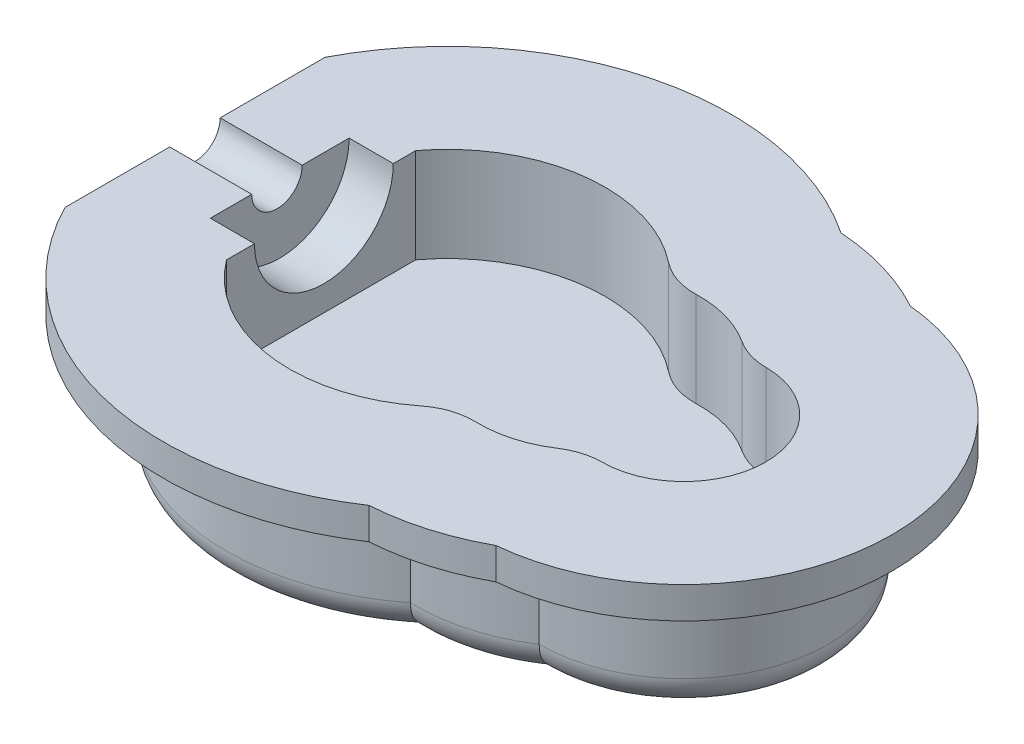
from build123d import *

# Parameters (mm, degrees)
SKETCH1_R           = 4
SKETCH1_R_2         = 11
BOSS_EXTRUDE1_DEPTH = 10
BOSS_EXTRUDE2_DEPTH = 20
BOSS_EXTRUDE3_DEPTH = 5
SKETCH6_R           = 11
CUT_EXTRUDE2_DEPTH  = 7
CUT_EXTRUDE3_REACH  = 123.903
SKETCH3_R           = 4
FILLET1_R           = 5


with BuildPart() as part:
    # Sketch1 → Boss-Extrude1 (new body)
    # profile 1 of 4: a face of its own
    with BuildSketch(Plane(origin=(0, 0, 0), x_dir=(1, 0, 0), z_dir=(0, 1, 0))):
        with BuildLine():
            ThreePointArc((-15.53030303, -17.49196326), (-18.965809959, -17.990656132), (-22.023809524, -19.633836312))
            ThreePointArc((-22.023809524, -19.633836312), (-40.737950416, -24.78942672), (-57.5, -15))
            Line((-57.5, -15), (-57.5, 15))
            ThreePointArc((-57.5, 15), (-40.737950416, 24.78942672), (-22.023809524, 19.633836312))
            ThreePointArc((-22.023809524, 19.633836312), (-18.965809959, 17.990656132), (-15.53030303, 17.49196326))
            ThreePointArc((-15.53030303, 17.49196326), (-10.248929974, 16.842723462), (-5.406818182, 14.63628582))
            ThreePointArc((-5.406818182, 14.63628582), (-2.801045952, 13.422385369), (0.042391304, 12.999930884))
            ThreePointArc((0.042391304, 12.999930884), (13, 0), (0.042391304, -12.999930884))
            ThreePointArc((0.042391304, -12.999930884), (-2.801045952, -13.422385369), (-5.406818182, -14.63628582))
            ThreePointArc((-5.406818182, -14.63628582), (-10.248929974, -16.842723462), (-15.53030303, -17.49196326))
        make_face()
        with Locations((-37.5, 0)):
            Circle(SKETCH1_R, mode=Mode.SUBTRACT)
        Circle(SKETCH1_R_2, mode=Mode.SUBTRACT)
        with Locations((-15, 0)):
            Circle(SKETCH1_R, mode=Mode.SUBTRACT)
    # profile 2 of 4: a face of its own
    with BuildSketch(Plane(origin=(0, 0, 0), x_dir=(1, 0, 0), z_dir=(0, 1, 0))):
        with Locations((-37.5, 0)):
            Circle(SKETCH1_R)
    # profile 3 of 4: a face of its own
    with BuildSketch(Plane(origin=(0, 0, 0), x_dir=(1, 0, 0), z_dir=(0, 1, 0))):
        with Locations((-15, 0)):
            Circle(SKETCH1_R)
    # profile 4 of 4: a face of its own
    with BuildSketch(Plane(origin=(0, 0, 0), x_dir=(1, 0, 0), z_dir=(0, 1, 0))):
        Circle(SKETCH1_R_2)
    extrude(amount=BOSS_EXTRUDE1_DEPTH)

    # Sketch1<3> → Boss-Extrude2 (add)
    with BuildSketch(Plane(origin=(0, 0, 0), x_dir=(1, 0, 0), z_dir=(0, 1, 0))):
        with BuildLine():
            Line((-67.5, -18.027756377), (-67.5, 18.027756377))
            ThreePointArc((-67.5, 18.027756377), (-43.803347329, 34.427718665), (-15.833333333, 27.487370837))
            ThreePointArc((-15.833333333, 27.487370837), (-7.534032816, 26.467136868), (0.075, 22.999877717))
            ThreePointArc((0.075, 22.999877717), (23, 0), (0.075, -22.999877717))
            ThreePointArc((0.075, -22.999877717), (-7.534032816, -26.467136868), (-15.833333333, -27.487370837))
            ThreePointArc((-15.833333333, -27.487370837), (-43.803347329, -34.427718665), (-67.5, -18.027756377))
        make_face()
        with BuildLine():
            Line((-57.5, -15), (-57.5, 15))
            ThreePointArc((-57.5, 15), (-40.737950416, 24.78942672), (-22.023809524, 19.633836312))
            ThreePointArc((-22.023809524, 19.633836312), (-18.965809959, 17.990656132), (-15.53030303, 17.49196326))
            ThreePointArc((-15.53030303, 17.49196326), (-10.248929974, 16.842723462), (-5.406818182, 14.63628582))
            ThreePointArc((-5.406818182, 14.63628582), (-2.801045952, 13.422385369), (0.042391304, 12.999930884))
            ThreePointArc((0.042391304, 12.999930884), (13, 0), (0.042391304, -12.999930884))
            ThreePointArc((0.042391304, -12.999930884), (-2.801045952, -13.422385369), (-5.406818182, -14.63628582))
            ThreePointArc((-5.406818182, -14.63628582), (-10.248929974, -16.842723462), (-15.53030303, -17.49196326))
            ThreePointArc((-15.53030303, -17.49196326), (-18.965809959, -17.990656132), (-22.023809524, -19.633836312))
            ThreePointArc((-22.023809524, -19.633836312), (-40.737950416, -24.78942672), (-57.5, -15))
        make_face(mode=Mode.SUBTRACT)
    extrude(amount=BOSS_EXTRUDE2_DEPTH)

    # Sketch2 → Boss-Extrude3 (add)
    with BuildSketch(Plane(origin=(0, 20, 0), x_dir=(1, 0, 0), z_dir=(0, 1, 0))):
        with BuildLine():
            Line((-77.5, -20.615528128), (-77.5, 20.615528128))
            ThreePointArc((-77.5, 20.615528128), (-48.761384661, 43.568121551), (-12.5, 37.416573868))
            ThreePointArc((-12.5, 37.416573868), (-4.462855904, 35.989145507), (3.075, 32.856420605))
            ThreePointArc((3.075, 32.856420605), (33, 0), (3.075, -32.856420605))
            ThreePointArc((3.075, -32.856420605), (-4.462855904, -35.989145507), (-12.5, -37.416573868))
            ThreePointArc((-12.5, -37.416573868), (-48.761384661, -43.568121551), (-77.5, -20.615528128))
        make_face()
        with BuildLine():
            Line((-57.5, -15), (-57.5, 15))
            ThreePointArc((-57.5, 15), (-40.737950416, 24.78942672), (-22.023809524, 19.633836312))
            ThreePointArc((-22.023809524, 19.633836312), (-18.965809959, 17.990656132), (-15.53030303, 17.49196326))
            ThreePointArc((-15.53030303, 17.49196326), (-10.248929974, 16.842723462), (-5.406818182, 14.63628582))
            ThreePointArc((-5.406818182, 14.63628582), (-2.801045952, 13.422385369), (0.042391304, 12.999930884))
            ThreePointArc((0.042391304, 12.999930884), (13, 0), (0.042391304, -12.999930884))
            ThreePointArc((0.042391304, -12.999930884), (-2.801045952, -13.422385369), (-5.406818182, -14.63628582))
            ThreePointArc((-5.406818182, -14.63628582), (-10.248929974, -16.842723462), (-15.53030303, -17.49196326))
            ThreePointArc((-15.53030303, -17.49196326), (-18.965809959, -17.990656132), (-22.023809524, -19.633836312))
            ThreePointArc((-22.023809524, -19.633836312), (-40.737950416, -24.78942672), (-57.5, -15))
        make_face(mode=Mode.SUBTRACT)
    extrude(amount=BOSS_EXTRUDE3_DEPTH)

    # Sketch6 → Cut-Extrude2 (cut)
    with BuildSketch(Plane(origin=(-57.5, 0, 0), x_dir=(0, 0, -1), z_dir=(1, 0, 0))):
        with Locations((0.437281594, 25)):
            Circle(SKETCH6_R)
    extrude(amount=-CUT_EXTRUDE2_DEPTH, mode=Mode.SUBTRACT)

    # Sketch3 → Cut-Extrude3 (cut, up to next)
    with BuildSketch(Plane.ZY.offset(77.5), mode=Mode.PRIVATE) as cut_extrude3_sk1:
        with Locations((0, 25)):
            Circle(SKETCH3_R)
    cut_extrude3_tool1 = extrude(cut_extrude3_sk1.sketch, amount=-CUT_EXTRUDE3_REACH, mode=Mode.PRIVATE) & part.part
    add(cut_extrude3_tool1.solids().sort_by_distance((-77.5, 25, 0))[0], mode=Mode.SUBTRACT)

    # Fillet1
    fillet1_edges = [part.edges().sort_by_distance(p)[0] for p in [
        (-43.803347329, 0, 34.427718665),
        (-7.534032816, 0, 26.467136868),
        (23, 0, 0),
        (-7.534032816, 0, -26.467136868),
        (-43.803347329, 0, -34.427718665),
        (-67.5, 0, 0),
    ]]
    fillet(fillet1_edges, radius=FILLET1_R - 0.0001)  # a hair under: the kernel refuses the full size


solid = part.part
